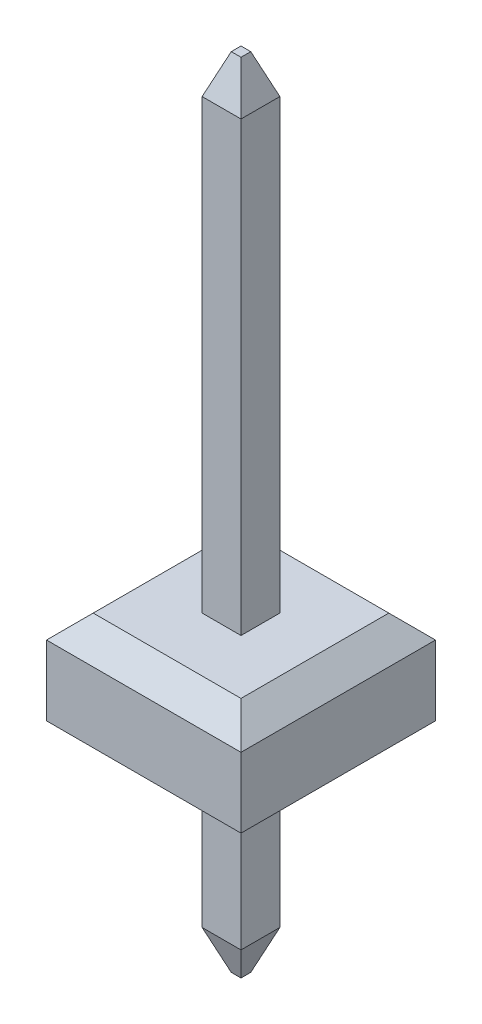
from build123d import *
from OCP.BRepFilletAPI import BRepFilletAPI_MakeChamfer

# Parameters (mm, degrees)
SKETCH1_W           = 2.54
SKETCH1_H           = 2.54
BOSS_EXTRUDE1_DEPTH = 1.524
SKETCH2_W           = 0.508
SKETCH2_H           = 0.508
BOSS_EXTRUDE2_DEPTH = 6.35
SKETCH3_W           = 0.508
SKETCH3_H           = 0.508
BOSS_EXTRUDE3_DEPTH = 2.54
CHAMFER1_SIZE       = 0.508
CHAMFER1_SIZE2      = 0.1905
CHAMFER2_SIZE       = 0.508
CHAMFER2_SIZE2      = 0.1905
CHAMFER4_SIZE       = 0.3048
CHAMFER5_SIZE       = 0.3048


with BuildPart() as part:
    # Sketch1 → Boss-Extrude1 (new body)
    with BuildSketch(Plane(origin=(0, 0, 0), x_dir=(1, 0, 0), z_dir=(0, 1, 0))):
        with Locations((1.27, 1.27)):
            Rectangle(SKETCH1_W, SKETCH1_H)
    extrude(amount=BOSS_EXTRUDE1_DEPTH)

    # Sketch2 → Boss-Extrude2 (add)
    with BuildSketch(Plane(origin=(0, 1.524, 0), x_dir=(1, 0, 0), z_dir=(0, 1, 0))):
        with Locations((1.27, 1.27)):
            Rectangle(SKETCH2_W, SKETCH2_H)
    extrude(amount=BOSS_EXTRUDE2_DEPTH)

    # Sketch3 → Boss-Extrude3 (add)
    with BuildSketch(Plane.XZ):
        with Locations((1.27, -1.27)):
            Rectangle(SKETCH3_W, SKETCH3_H)
    extrude(amount=BOSS_EXTRUDE3_DEPTH)

    # Chamfer1: one chamfer whose edges measure the first distance from different faces: ONE call of the kernel's chamfer builder (chamfer() names one face for all edges)
    chamfer1_edges_1 = [part.edges().sort_by_distance(p)[0] for p in [
        (1.524, 7.874, -1.27),
    ]]
    chamfer1_side_1 = [part.faces().sort_by_distance(p)[0] for p in [
        (1.524, 4.699, -1.27),
    ]]
    chamfer1_edges_2 = [part.edges().sort_by_distance(p)[0] for p in [
        (1.27, 7.874, -1.524),
    ]]
    chamfer1_side_2 = [part.faces().sort_by_distance(p)[0] for p in [
        (1.27, 4.699, -1.524),
    ]]
    chamfer1_edges_3 = [part.edges().sort_by_distance(p)[0] for p in [
        (1.016, 7.874, -1.27),
    ]]
    chamfer1_side_3 = [part.faces().sort_by_distance(p)[0] for p in [
        (1.016, 4.699, -1.27),
    ]]
    chamfer1_edges_4 = [part.edges().sort_by_distance(p)[0] for p in [
        (1.27, 7.874, -1.016),
    ]]
    chamfer1_side_4 = [part.faces().sort_by_distance(p)[0] for p in [
        (1.27, 4.699, -1.016),
    ]]
    chamfer1 = BRepFilletAPI_MakeChamfer(part.part.solid().wrapped)
    for e in chamfer1_edges_1:
        chamfer1.Add(CHAMFER1_SIZE, CHAMFER1_SIZE2, e.wrapped, chamfer1_side_1[0].wrapped)  # the first distance lies on this face
    for e in chamfer1_edges_2:
        chamfer1.Add(CHAMFER1_SIZE, CHAMFER1_SIZE2, e.wrapped, chamfer1_side_2[0].wrapped)  # the first distance lies on this face
    for e in chamfer1_edges_3:
        chamfer1.Add(CHAMFER1_SIZE, CHAMFER1_SIZE2, e.wrapped, chamfer1_side_3[0].wrapped)  # the first distance lies on this face
    for e in chamfer1_edges_4:
        chamfer1.Add(CHAMFER1_SIZE, CHAMFER1_SIZE2, e.wrapped, chamfer1_side_4[0].wrapped)  # the first distance lies on this face
    add(Compound.cast(chamfer1.Shape()), mode=Mode.REPLACE)

    # Chamfer2: one chamfer whose edges measure the first distance from different faces: ONE call of the kernel's chamfer builder (chamfer() names one face for all edges)
    chamfer2_edges_1 = [part.edges().sort_by_distance(p)[0] for p in [
        (1.524, -2.54, -1.27),
    ]]
    chamfer2_side_1 = [part.faces().sort_by_distance(p)[0] for p in [
        (1.524, -1.27, -1.27),
    ]]
    chamfer2_edges_2 = [part.edges().sort_by_distance(p)[0] for p in [
        (1.27, -2.54, -1.524),
    ]]
    chamfer2_side_2 = [part.faces().sort_by_distance(p)[0] for p in [
        (1.27, -1.27, -1.524),
    ]]
    chamfer2_edges_3 = [part.edges().sort_by_distance(p)[0] for p in [
        (1.016, -2.54, -1.27),
    ]]
    chamfer2_side_3 = [part.faces().sort_by_distance(p)[0] for p in [
        (1.016, -1.27, -1.27),
    ]]
    chamfer2_edges_4 = [part.edges().sort_by_distance(p)[0] for p in [
        (1.27, -2.54, -1.016),
    ]]
    chamfer2_side_4 = [part.faces().sort_by_distance(p)[0] for p in [
        (1.27, -1.27, -1.016),
    ]]
    chamfer2 = BRepFilletAPI_MakeChamfer(part.part.solid().wrapped)
    for e in chamfer2_edges_1:
        chamfer2.Add(CHAMFER2_SIZE, CHAMFER2_SIZE2, e.wrapped, chamfer2_side_1[0].wrapped)  # the first distance lies on this face
    for e in chamfer2_edges_2:
        chamfer2.Add(CHAMFER2_SIZE, CHAMFER2_SIZE2, e.wrapped, chamfer2_side_2[0].wrapped)  # the first distance lies on this face
    for e in chamfer2_edges_3:
        chamfer2.Add(CHAMFER2_SIZE, CHAMFER2_SIZE2, e.wrapped, chamfer2_side_3[0].wrapped)  # the first distance lies on this face
    for e in chamfer2_edges_4:
        chamfer2.Add(CHAMFER2_SIZE, CHAMFER2_SIZE2, e.wrapped, chamfer2_side_4[0].wrapped)  # the first distance lies on this face
    add(Compound.cast(chamfer2.Shape()), mode=Mode.REPLACE)

    # Chamfer4
    chamfer4_edges = [part.edges().sort_by_distance(p)[0] for p in [
        (2.54, 1.524, -1.27),
        (1.27, 1.524, -2.54),
        (0, 1.524, -1.27),
        (1.27, 1.524, 0),
    ]]
    chamfer(chamfer4_edges, length=CHAMFER4_SIZE)

    # Chamfer5
    chamfer5_edges = [part.edges().sort_by_distance(p)[0] for p in [
        (2.54, 0, -1.27),
        (1.27, 0, -2.54),
        (0, 0, -1.27),
        (1.27, 0, 0),
    ]]
    chamfer(chamfer5_edges, length=CHAMFER5_SIZE)


solid = part.part
